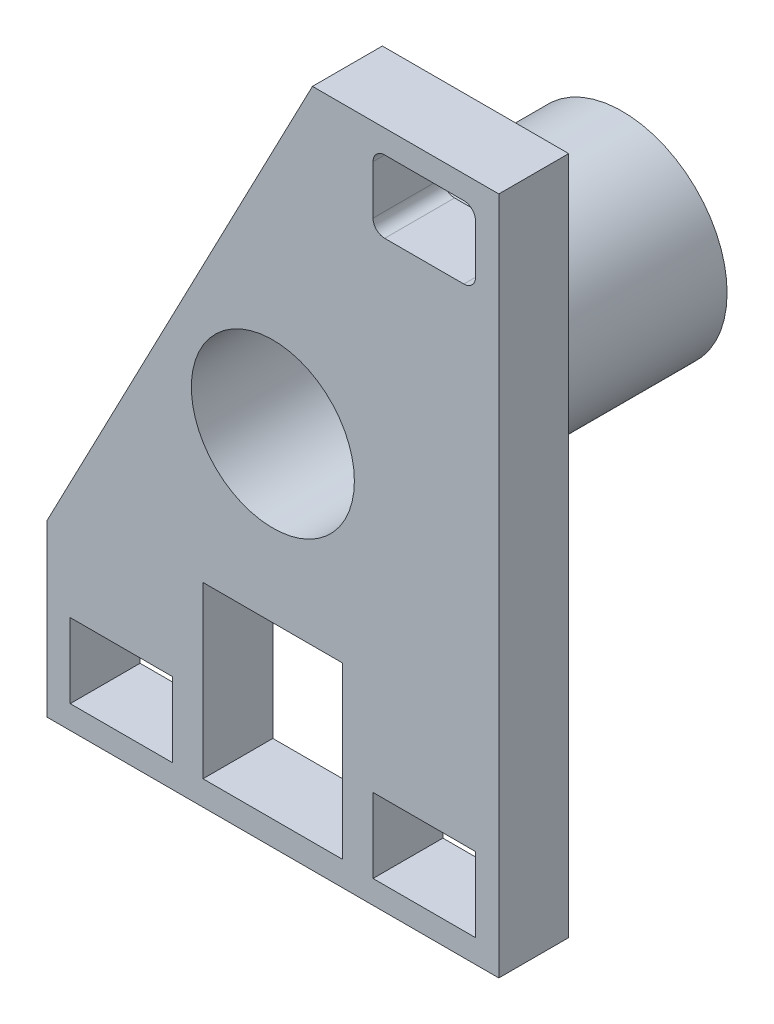
from build123d import *
from build123d.topology import SkipClean

# Parameters (mm, degrees)
SKETCH2_W           = 44
SKETCH2_H           = 31
SKETCH2_H_2         = 32
SKETCH2_W_2         = 60
SKETCH2_H_3         = 73
BOSS_EXTRUDE1_DEPTH = 30
SKETCH3_R           = 45
SKETCH3_R_2         = 35
BOSS_EXTRUDE2_DEPTH = 120
FILLET1_R           = 5
SKETCH6_R           = 35
CUT_EXTRUDE1_DEPTH  = 120
FILLET2_R           = 5


with BuildPart() as part:
    # Sketch2 → Boss-Extrude1 (new body)
    with BuildSketch(Plane.XY):
        Polygon((22.104569931, 160.536781585), (102.104569931, 160.536781585), (102.104569931, -130.963218415), (-91.895430069, -130.963218415), (-91.895430069, -57.963218415), align=None)
        with Locations((70.104569931, 135.036781585)):
            Rectangle(SKETCH2_W, SKETCH2_H, mode=Mode.SUBTRACT)
        with Locations((70.104569931, -104.963218415)):
            Rectangle(SKETCH2_W, SKETCH2_H_2, mode=Mode.SUBTRACT)
        with Locations((-59.895430069, -104.963218415)):
            Rectangle(SKETCH2_W, SKETCH2_H_2, mode=Mode.SUBTRACT)
        with Locations((5.104569931, -83.895986651)):
            Rectangle(SKETCH2_W_2, SKETCH2_H_3, mode=Mode.SUBTRACT)
    extrude(amount=BOSS_EXTRUDE1_DEPTH)

    # Sketch3 → Boss-Extrude2 (add)
    with BuildSketch(Plane(origin=(0, 0, 0), x_dir=(-1, 0, 0), z_dir=(0, 0, -1))):
        with Locations((-5.104569931, 22.786781585)):
            Circle(SKETCH3_R)
        with Locations((-5.104569931, 22.786781585)):
            Circle(SKETCH3_R_2, mode=Mode.SUBTRACT)
    extrude(amount=BOSS_EXTRUDE2_DEPTH)

    # Fillet1
    fillet1_edges = [part.edges().sort_by_distance(p)[0] for p in [
        (92.104569931, 119.536781585, 15),
        (48.104569931, 119.536781585, 15),
        (92.104569931, 150.536781585, 15),
        (48.104569931, 150.536781585, 15),
    ]]
    fillet(fillet1_edges, radius=FILLET1_R)

    # Sketch6 → Cut-Extrude1 (cut)
    with SkipClean():  # the faces are left unmerged after this step: merging them gives an invalid solid
        with BuildSketch(Plane.XY.offset(30)):
            with Locations((5.104569931, 22.786781585)):
                Circle(SKETCH6_R)
        extrude(amount=-CUT_EXTRUDE1_DEPTH, mode=Mode.SUBTRACT)
    add(part.part.scale(1), mode=Mode.REPLACE)  # the faces are merged on a copy

    # Fillet2
    fillet2_edges = [part.edges().sort_by_distance(p)[0] for p in [
        (50.104569931, 22.786781585, 0),
    ]]
    fillet(fillet2_edges, radius=FILLET2_R)


solid = part.part
